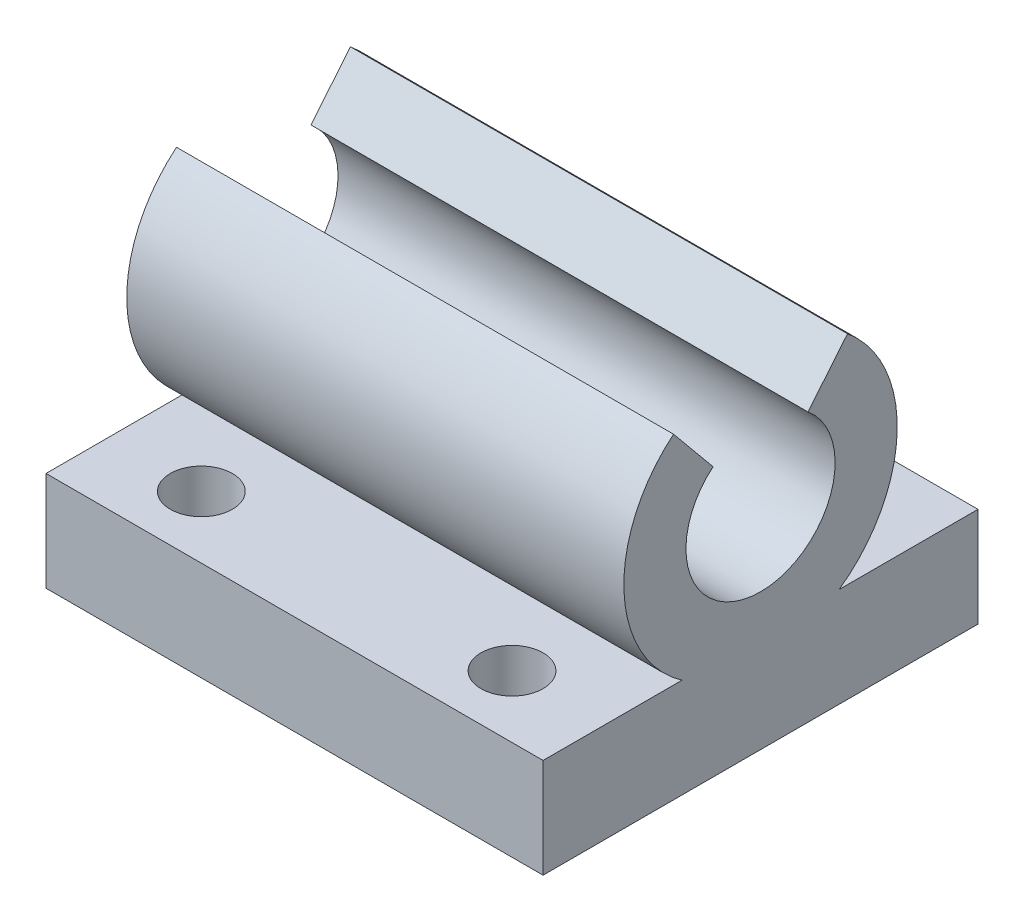
from build123d import *

# Parameters (mm, degrees)
EXTRUDE_1_DEPTH     = 20
CUT_EXTRUDE_1_REACH = 38.821
SKETCH_3_R          = 2.5


with BuildPart() as part:
    # Эскиз2 → Бобышка-Вытянуть1 (new, symmetric)
    with BuildSketch(Plane(origin=(0, 0, 0), x_dir=(0, 0, -1), z_dir=(1, 0, 0))):
        with BuildLine():
            Line((-3.818181818, 21.628335295), (-7, 25.485281374))
            ThreePointArc((-7, 25.485281374), (-10.991801936, 16.575394071), (-6.32455532, 8))
            Line((-6.32455532, 8), (-17.5, 8))
            Line((-17.5, 8), (-17.5, 0))
            Line((-17.5, 0), (17.5, 0))
            Line((17.5, 0), (17.5, 8))
            Line((17.5, 8), (6.32455532, 8))
            ThreePointArc((6.32455532, 8), (10.991801936, 16.575394071), (7, 25.485281374))
            Line((7, 25.485281374), (3.818181818, 21.628335295))
            ThreePointArc((3.818181818, 21.628335295), (0, 11), (-3.818181818, 21.628335295))
        make_face()
    extrude(amount=EXTRUDE_1_DEPTH, both=True)

    # Эскиз3 → Вырез-Вытянуть1 (cut, up to next)
    with BuildSketch(Plane.XZ, mode=Mode.PRIVATE) as cut_extrude_1_sk1:
        with Locations((-12.5, 12.5)):
            Circle(SKETCH_3_R)
    cut_extrude_1_tool1 = extrude(cut_extrude_1_sk1.sketch, amount=-CUT_EXTRUDE_1_REACH, mode=Mode.PRIVATE) & part.part
    # Эскиз3 → Вырез-Вытянуть1 (cut, up to next)
    with BuildSketch(Plane.XZ, mode=Mode.PRIVATE) as cut_extrude_1_sk2:
        with Locations((12.5, 12.5)):
            Circle(SKETCH_3_R)
    cut_extrude_1_tool2 = extrude(cut_extrude_1_sk2.sketch, amount=-CUT_EXTRUDE_1_REACH, mode=Mode.PRIVATE) & part.part
    # Эскиз3 → Вырез-Вытянуть1 (cut, up to next)
    with BuildSketch(Plane.XZ, mode=Mode.PRIVATE) as cut_extrude_1_sk3:
        with Locations((-12.5, -12.5)):
            Circle(SKETCH_3_R)
    cut_extrude_1_tool3 = extrude(cut_extrude_1_sk3.sketch, amount=-CUT_EXTRUDE_1_REACH, mode=Mode.PRIVATE) & part.part
    # Эскиз3 → Вырез-Вытянуть1 (cut, up to next)
    with BuildSketch(Plane.XZ, mode=Mode.PRIVATE) as cut_extrude_1_sk4:
        with Locations((12.5, -12.5)):
            Circle(SKETCH_3_R)
    cut_extrude_1_tool4 = extrude(cut_extrude_1_sk4.sketch, amount=-CUT_EXTRUDE_1_REACH, mode=Mode.PRIVATE) & part.part
    add(cut_extrude_1_tool1.solids().sort_by_distance((-12.5, 0, 12.5))[0], mode=Mode.SUBTRACT)
    add(cut_extrude_1_tool2.solids().sort_by_distance((12.5, 0, 12.5))[0], mode=Mode.SUBTRACT)
    add(cut_extrude_1_tool3.solids().sort_by_distance((-12.5, 0, -12.5))[0], mode=Mode.SUBTRACT)
    add(cut_extrude_1_tool4.solids().sort_by_distance((12.5, 0, -12.5))[0], mode=Mode.SUBTRACT)


solid = part.part
